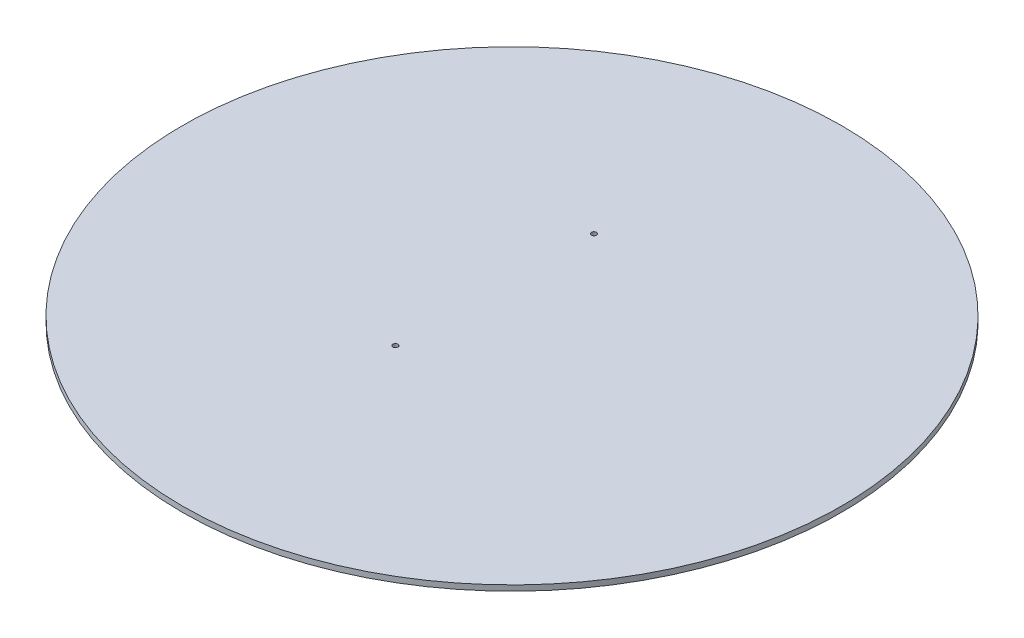
from build123d import *

# Parameters (mm, degrees)
SKETCH2_R           = 304.8
BOSS_EXTRUDE1_DEPTH = 5.08
SKETCH3_R           = 2.3495
CUT_EXTRUDE1_DEPTH  = 551.437876962


with BuildPart() as part:
    # Sketch2 → Boss-Extrude1 (new body)
    with BuildSketch(Plane(origin=(0, 0, 0), x_dir=(1, 0, 0), z_dir=(0, 1, 0))):
        Circle(SKETCH2_R)
    extrude(amount=BOSS_EXTRUDE1_DEPTH)

    # Sketch3 → Cut-Extrude1 (cut, through all)
    with BuildSketch(Plane(origin=(-66.199681488, 84.022812745, -93.045773722), x_dir=(0.9941524009920281, -0.1079843831563281, -0.0006136742891854778), z_dir=(0.10794896477866957, 0.99364514955026, 0.031880052987017495))):
        with Locations((44.353535624, -173.175566882)):
            Circle(SKETCH3_R)
        with Locations((46.68181957, 8.1642617)):
            Circle(SKETCH3_R)
    extrude(amount=-CUT_EXTRUDE1_DEPTH, mode=Mode.SUBTRACT)


solid = part.part
